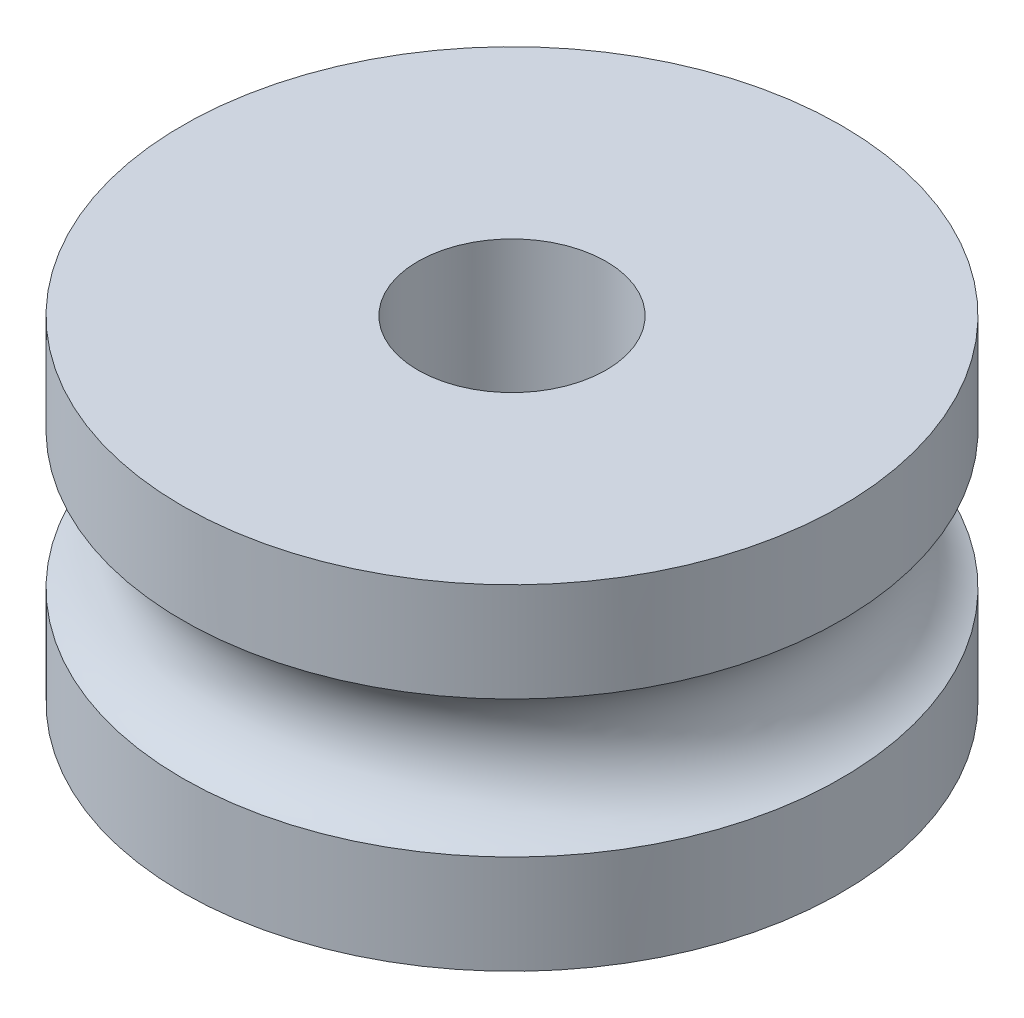
from build123d import *

# Parameters (mm, degrees)
SKETCH1_R           = 7.875
SKETCH1_R_2         = 2.25
BOSS_EXTRUDE1_DEPTH = 8
SKETCH3_R           = 4
CUT_EXTRUDE2_DEPTH  = 3
SKETCH11_R          = 1.75


with BuildPart() as part:
    # Sketch1 → Boss-Extrude1 (new body)
    with BuildSketch(Plane(origin=(0, 0, 0), x_dir=(1, 0, 0), z_dir=(0, 1, 0))):
        Circle(SKETCH1_R)
        Circle(SKETCH1_R_2, mode=Mode.SUBTRACT)
    extrude(amount=BOSS_EXTRUDE1_DEPTH)

    # Sketch3 → Cut-Extrude2 (cut)
    with BuildSketch(Plane(origin=(0, 0, 0), x_dir=(-1, 0, 0), z_dir=(0, -1, 0))):
        Circle(SKETCH3_R)
    extrude(amount=-CUT_EXTRUDE2_DEPTH, mode=Mode.SUBTRACT)

    # Sketch11 → Cut-Revolve1 (revolve, cut)
    with BuildSketch(Plane.XY):
        with Locations((-8.5, 4)):
            Circle(SKETCH11_R)
    revolve(axis=Axis((0, 0, 0), (0, 1, 0)), mode=Mode.SUBTRACT)


solid = part.part
